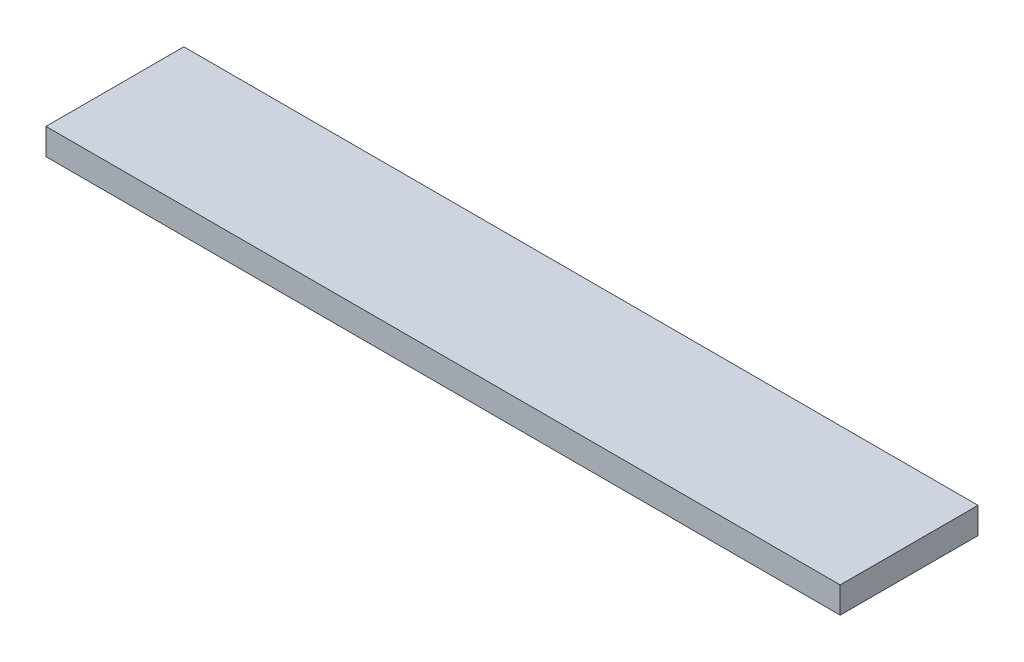
from build123d import *

# Parameters (mm, degrees)
SKETCH1_W           = 121
SKETCH1_H           = 21
BOSS_EXTRUDE1_DEPTH = 4


with BuildPart() as part:
    # Sketch1 → Boss-Extrude1 (new body)
    with BuildSketch(Plane(origin=(0, 0, 0), x_dir=(1, 0, 0), z_dir=(0, 1, 0))):
        Rectangle(SKETCH1_W, SKETCH1_H)
    extrude(amount=BOSS_EXTRUDE1_DEPTH)


solid = part.part
